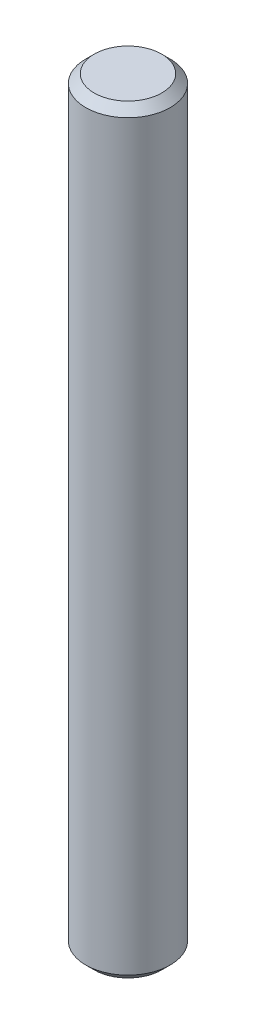
from build123d import *

# Parameters (mm, degrees)
SKETCH1_R           = 3.175
BOSS_EXTRUDE1_DEPTH = 57.15
CHAMFER1_SIZE       = 0.635


with BuildPart() as part:
    # Sketch1 → Boss-Extrude1 (new body)
    with BuildSketch(Plane(origin=(0, 0, 0), x_dir=(1, 0, 0), z_dir=(0, 1, 0))):
        Circle(SKETCH1_R)
    extrude(amount=BOSS_EXTRUDE1_DEPTH)

    # Chamfer1
    chamfer1_edges = [part.edges().sort_by_distance(p)[0] for p in [
        (-3.175, 0, 0),
        (-3.175, 57.15, 0),
    ]]
    chamfer(chamfer1_edges, length=CHAMFER1_SIZE)


solid = part.part
